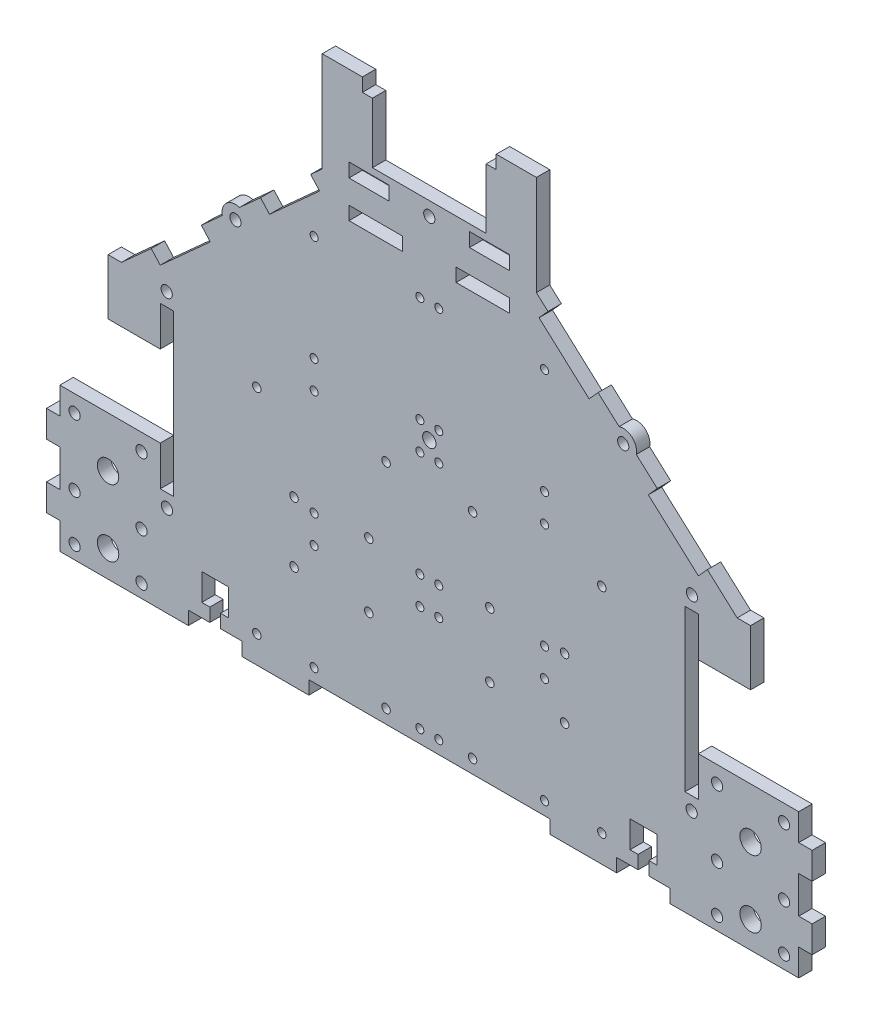
from build123d import *

# Parameters (mm, degrees)
SKETCH1_W               = 240
SKETCH1_H               = 210
BOSS_EXTRUDE1_DEPTH     = 5
SKETCH3_W               = 5
SKETCH3_H               = 65
BOSS_EXTRUDE2_DEPTH     = 20
SKETCH2_R               = 2.1
SKETCH2_R_2             = 4
CUT_EXTRUDE1_DEPTH      = 10
SKETCH4_W               = 55
SKETCH4_H               = 30.4
CUT_EXTRUDE2_DEPTH      = 20
SKETCH5_R               = 4
CUT_EXTRUDE4_DEPTH      = 10
SKETCH6_R               = 2.1
SKETCH6_W               = 5
SKETCH6_H               = 60
CUT_EXTRUDE5_DEPTH      = 10
CUT_EXTRUDE13_START     = -5
CUT_EXTRUDE13_DEPTH     = 5
SKETCH13_W              = 50
SKETCH13_H              = 5
CUT_EXTRUDE14_DEPTH     = 10
SKETCH14_W              = 15
SKETCH14_H              = 5.2
CUT_EXTRUDE15_DEPTH     = 10
CUT_EXTRUDE16_OUTLINE_R = 2.1
CUT_EXTRUDE16_DEPTH     = 5
BOSS_EXTRUDE3_DEPTH     = 5
CUT_EXTRUDE17_START     = -5
CUT_EXTRUDE17_OUTLINE_R = 1.5875
CUT_EXTRUDE17_DEPTH     = 5
CUT_EXTRUDE18_OUTLINE_R = 1.5
CUT_EXTRUDE18_DEPTH     = 5
CUT_EXTRUDE19_DEPTH     = 10
SKETCH20_R              = 2.1
CUT_EXTRUDE20_DEPTH     = 10
SKETCH21_R              = 2.1
CUT_EXTRUDE21_DEPTH     = 10
SKETCH22_R              = 2.5
CUT_EXTRUDE22_DEPTH     = 5
SKETCH24_W              = 4.2
SKETCH24_H              = 5
CUT_EXTRUDE24_DEPTH     = 10
SKETCH25_W              = 5
SKETCH25_H              = 53.8
CUT_EXTRUDE25_DEPTH     = 2
SKETCH26_W              = 5
SKETCH26_H              = 53.8
CUT_EXTRUDE26_DEPTH     = 2
SKETCH27_W              = 5
SKETCH27_H              = 10
BOSS_EXTRUDE4_DEPTH     = 5
SKETCH30_W              = 20
SKETCH30_H              = 5
CUT_EXTRUDE27_DEPTH     = 5
SKETCH32_W              = 90
SKETCH32_H              = 5
CUT_EXTRUDE28_DEPTH     = 5
SKETCH33_W              = 10
SKETCH33_H              = 10
SKETCH33_W_2            = 4
SKETCH33_H_2            = 5
CUT_EXTRUDE29_DEPTH     = 5
SKETCH34_W              = 10
SKETCH34_H              = 1.8
CUT_EXTRUDE30_DEPTH     = 5
BOSS_EXTRUDE8_DEPTH     = 5
SKETCH36_W              = 42.5
SKETCH36_H              = 10
CUT_EXTRUDE31_DEPTH     = 5
SKETCH37_W              = 7
SKETCH37_H              = 5
SKETCH37_W_2            = 4
SKETCH37_H_2            = 2.5
CUT_EXTRUDE32_DEPTH     = 5
BOSS_EXTRUDE9_START     = -5
SKETCH38_R              = 2.1
SKETCH38_W              = 5
SKETCH38_H              = 60
BOSS_EXTRUDE9_DEPTH     = 5
SKETCH39_W              = 42.5
SKETCH39_H              = 22.5
CUT_EXTRUDE33_DEPTH     = 5


# Read off the part's stored shape, not the designer's step: Cut-Extrude13, Cut-Extrude16, Cut-Extrude17, Cut-Extrude18
with BuildPart() as part:
    # Sketch1 → Boss-Extrude1 (new body)
    with BuildSketch(Plane.XY):
        with Locations((-120, 105)):
            Rectangle(SKETCH1_W, SKETCH1_H)
    extrude(amount=BOSS_EXTRUDE1_DEPTH)

    # Sketch3 → Boss-Extrude2 (add)
    with BuildSketch(Plane(origin=(0, 0, 0), x_dir=(0, 0, -1), z_dir=(1, 0, 0))):
        with Locations((-2.5, 32.5)):
            Rectangle(SKETCH3_W, SKETCH3_H)
    boss_extrude2 = extrude(amount=BOSS_EXTRUDE2_DEPTH)

    # Mirror1: Boss-Extrude2 across plane
    add(boss_extrude2.mirror(Plane.ZY.offset(120)))

    # Sketch2 → Cut-Extrude1 (cut)
    with BuildSketch(Plane.XY.offset(5)):
        with Locations((-12.5, 22.5)):
            Circle(SKETCH2_R)
        with Locations((0, 35)):
            Circle(SKETCH2_R_2)
        with Locations((12.5, 47.5)):
            Circle(SKETCH2_R)
        with Locations((-252.5, 47.5)):
            Circle(SKETCH2_R)
        with Locations((-240, 35)):
            Circle(SKETCH2_R_2)
        with Locations((-227.5, 22.5)):
            Circle(SKETCH2_R)
        with BuildLine():
            Line((-240.00216949, 53.8), (-220.500048658, 53.8))
            Line((-220.500048658, 53.8), (-220.500048658, 55.8))
            Line((-220.500048658, 55.8), (-220.500048658, 82.2))
            Line((-220.500048658, 82.2), (-220.500048658, 84.2))
            Line((-220.500048658, 84.2), (-240.00216949, 84.2))
            ThreePointArc((-240.00216949, 84.2), (-255.20216949, 69), (-240.00216949, 53.8))
        make_face()
        with BuildLine():
            Line((-19.499951342, 82.2), (-19.499951342, 84.2))
            Line((-19.499951342, 84.2), (0.00216949, 84.2))
            ThreePointArc((0.00216949, 84.2), (15.20216949, 69), (0.00216949, 53.8))
            Line((0.00216949, 53.8), (-19.499951342, 53.8))
            Line((-19.499951342, 53.8), (-19.499951342, 55.8))
            Line((-19.499951342, 55.8), (-19.499951342, 82.2))
        make_face()
    extrude(amount=-CUT_EXTRUDE1_DEPTH, mode=Mode.SUBTRACT)

    # Sketch4 → Cut-Extrude2 (cut)
    with BuildSketch(Plane.XY.offset(5)):
        with Locations((-246.18319816, 69)):
            Rectangle(SKETCH4_W, SKETCH4_H)
        with Locations((6.18319816, 69)):
            Rectangle(SKETCH4_W, SKETCH4_H)
    extrude(amount=-CUT_EXTRUDE2_DEPTH, mode=Mode.SUBTRACT)

    # Sketch5 → Cut-Extrude4 (cut)
    with BuildSketch(Plane.XY.offset(5)):
        with Locations((-240, 10)):
            Circle(SKETCH5_R)
        with Locations((0, 10)):
            Circle(SKETCH5_R)
    extrude(amount=-CUT_EXTRUDE4_DEPTH, mode=Mode.SUBTRACT)

    # Sketch6 → Cut-Extrude5 (cut)
    with BuildSketch(Plane.XY.offset(5)):
        with Locations((-218, 34)):
            Circle(SKETCH6_R)
        with Locations((-218.1, 104)):
            Circle(SKETCH6_R)
        with Locations((-203.1, 104)):
            Circle(SKETCH6_R)
        with Locations((-203, 34)):
            Circle(SKETCH6_R)
        with Locations((-37, 34)):
            Circle(SKETCH6_R)
        with Locations((-36.9, 104)):
            Circle(SKETCH6_R)
        with Locations((-22, 34)):
            Circle(SKETCH6_R)
        with Locations((-21.9, 104)):
            Circle(SKETCH6_R)
        with Locations((-218, 69)):
            Rectangle(SKETCH6_W, SKETCH6_H)
        with Locations((-203, 69)):
            Rectangle(SKETCH6_W, SKETCH6_H)
        with Locations((-37, 69)):
            Rectangle(SKETCH6_W, SKETCH6_H)
        with Locations((-22, 69)):
            Rectangle(SKETCH6_W, SKETCH6_H)
    extrude(amount=-CUT_EXTRUDE5_DEPTH, mode=Mode.SUBTRACT)

    # Cut-Extrude13 outline → Cut-Extrude13 (cut)
    with BuildSketch(Plane(origin=(0, 0, 0), x_dir=(-1, 0, 0), z_dir=(0, 0, -1)).offset(CUT_EXTRUDE13_START)):
        Polygon((170, 163.680555556), (235, 105), (240, 105), (240, 210), (170, 210), align=None)
        Polygon((70, 163.680555556), (70, 210), (0, 210), (0, 105), (5, 105), align=None)
    extrude(amount=CUT_EXTRUDE13_DEPTH, mode=Mode.SUBTRACT)

    # Sketch13 → Cut-Extrude14 (cut)
    with BuildSketch(Plane.XY.offset(5)):
        with Locations((-120, 207.5)):
            Rectangle(SKETCH13_W, SKETCH13_H)
    extrude(amount=-CUT_EXTRUDE14_DEPTH, mode=Mode.SUBTRACT)

    # Sketch14 → Cut-Extrude15 (cut)
    with BuildSketch(Plane.XY.offset(5)):
        with Locations((-142.5, 177.4)):
            Rectangle(SKETCH14_W, SKETCH14_H)
        with Locations((-97.5, 177.4)):
            Rectangle(SKETCH14_W, SKETCH14_H)
    extrude(amount=-CUT_EXTRUDE15_DEPTH, mode=Mode.SUBTRACT)

    # Cut-Extrude16 outline → Cut-Extrude16 (cut)
    with BuildSketch(Plane.XY):
        Polygon((-70, 175.067692308), (-79.01443299, 165.082474227), (-60.309278351, 148.195876289), (-56.958762887, 151.907216495), (-70, 163.680555556), align=None)
        Polygon((-16.134020619, 115.051546392), (-34.839175258, 131.93814433), (-38.189690722, 128.226804124), (-19.484536082, 111.340206186), align=None)
        Polygon((-201.810309278, 128.226804124), (-205.160824742, 131.93814433), (-223.865979381, 115.051546392), (-220.515463918, 111.340206186), align=None)
        Polygon((-179.690721649, 148.195876289), (-160.98556701, 165.082474227), (-170, 175.067692308), (-170, 163.680555556), (-183.041237113, 151.907216495), align=None)
        with Locations((-47.574226804, 140.067010309)):
            Circle(CUT_EXTRUDE16_OUTLINE_R)
        with Locations((-192.425773196, 140.067010309)):
            Circle(CUT_EXTRUDE16_OUTLINE_R)
    extrude(amount=CUT_EXTRUDE16_DEPTH, mode=Mode.SUBTRACT)

    # Sketch16 → Boss-Extrude3 (add)
    with BuildSketch(Plane.XY.offset(5)):
        with BuildLine():
            Line((-197.315145828, 139.021048905), (-190.886916027, 144.82431192))
            ThreePointArc((-190.886916027, 144.82431192), (-195.77628866, 143.778350515), (-197.315145828, 139.021048905))
        make_face()
        with BuildLine():
            Line((-42.684854172, 139.021048905), (-49.113083973, 144.82431192))
            ThreePointArc((-49.113083973, 144.82431192), (-44.22371134, 143.778350515), (-42.684854172, 139.021048905))
        make_face()
    extrude(amount=-BOSS_EXTRUDE3_DEPTH)

    # Cut-Extrude17 outline → Cut-Extrude17 (cut)
    with BuildSketch(Plane.XY.offset(5).offset(CUT_EXTRUDE17_START)):
        with Locations((-142.601004846, 62.025562398)):
            Circle(CUT_EXTRUDE17_OUTLINE_R)
        with Locations((-97.398995154, 37.974437602)):
            Circle(CUT_EXTRUDE17_OUTLINE_R)
        with Locations((-184.429681634, 89.892779237)):
            Circle(CUT_EXTRUDE17_OUTLINE_R)
        with Locations((-136.152974, 89.892779237)):
            Circle(CUT_EXTRUDE17_OUTLINE_R)
        with Locations((-170.531335353, 38.709446299)):
            Circle(CUT_EXTRUDE17_OUTLINE_R)
        with Locations((-69.468664647, 38.709446299)):
            Circle(CUT_EXTRUDE17_OUTLINE_R)
        with Locations((-103.847026, 89.892779237)):
            Circle(CUT_EXTRUDE17_OUTLINE_R)
        with Locations((-55.570318366, 89.892779237)):
            Circle(CUT_EXTRUDE17_OUTLINE_R)
        with Locations((-97.398995154, 62.025562398)):
            Circle(CUT_EXTRUDE17_OUTLINE_R)
        with Locations((-184.429681634, 10.107220763)):
            Circle(CUT_EXTRUDE17_OUTLINE_R)
        with Locations((-136.152974, 10.107220763)):
            Circle(CUT_EXTRUDE17_OUTLINE_R)
        with Locations((-170.531335353, 61.290553701)):
            Circle(CUT_EXTRUDE17_OUTLINE_R)
        with Locations((-142.601004846, 37.974437602)):
            Circle(CUT_EXTRUDE17_OUTLINE_R)
        with Locations((-55.570318366, 10.107220763)):
            Circle(CUT_EXTRUDE17_OUTLINE_R)
        with Locations((-103.847026, 10.107220763)):
            Circle(CUT_EXTRUDE17_OUTLINE_R)
        with Locations((-69.468664647, 61.290553701)):
            Circle(CUT_EXTRUDE17_OUTLINE_R)
    extrude(amount=CUT_EXTRUDE17_DEPTH, mode=Mode.SUBTRACT)

    # Cut-Extrude18 outline → Cut-Extrude18 (cut)
    with BuildSketch(Plane.XY):
        with Locations((-123.531606957, 49.385290972)):
            Circle(CUT_EXTRUDE18_OUTLINE_R)
        with Locations((-163.031606957, 149.385290972)):
            Circle(CUT_EXTRUDE18_OUTLINE_R)
        with Locations((-163.031606957, 109.885290972)):
            Circle(CUT_EXTRUDE18_OUTLINE_R)
        with Locations((-123.531606957, 109.885290972)):
            Circle(CUT_EXTRUDE18_OUTLINE_R)
        with Locations((-116.468393043, 149.385290972)):
            Circle(CUT_EXTRUDE18_OUTLINE_R)
        with Locations((-76.968393043, 149.385290972)):
            Circle(CUT_EXTRUDE18_OUTLINE_R)
        with Locations((-76.968393043, 109.885290972)):
            Circle(CUT_EXTRUDE18_OUTLINE_R)
        with Locations((-116.468393043, 109.885290972)):
            Circle(CUT_EXTRUDE18_OUTLINE_R)
        with Locations((-123.531606957, 99.385290972)):
            Circle(CUT_EXTRUDE18_OUTLINE_R)
        with Locations((-116.468393043, 9.885290972)):
            Circle(CUT_EXTRUDE18_OUTLINE_R)
        with Locations((-76.968393043, 9.885290972)):
            Circle(CUT_EXTRUDE18_OUTLINE_R)
        with Locations((-76.968393043, 49.385290972)):
            Circle(CUT_EXTRUDE18_OUTLINE_R)
        with Locations((-116.468393043, 49.385290972)):
            Circle(CUT_EXTRUDE18_OUTLINE_R)
        with Locations((-123.531606957, 9.885290972)):
            Circle(CUT_EXTRUDE18_OUTLINE_R)
        with Locations((-163.031606957, 9.885290972)):
            Circle(CUT_EXTRUDE18_OUTLINE_R)
        with Locations((-163.031606957, 49.385290972)):
            Circle(CUT_EXTRUDE18_OUTLINE_R)
        with Locations((-123.531606957, 149.385290972)):
            Circle(CUT_EXTRUDE18_OUTLINE_R)
        with Locations((-116.468393043, 59.885290972)):
            Circle(CUT_EXTRUDE18_OUTLINE_R)
        with Locations((-76.968393043, 59.885290972)):
            Circle(CUT_EXTRUDE18_OUTLINE_R)
        with Locations((-76.968393043, 99.385290972)):
            Circle(CUT_EXTRUDE18_OUTLINE_R)
        with Locations((-116.468393043, 99.385290972)):
            Circle(CUT_EXTRUDE18_OUTLINE_R)
        with Locations((-123.531606957, 59.885290972)):
            Circle(CUT_EXTRUDE18_OUTLINE_R)
        with Locations((-163.031606957, 59.885290972)):
            Circle(CUT_EXTRUDE18_OUTLINE_R)
        with Locations((-163.031606957, 99.385290972)):
            Circle(CUT_EXTRUDE18_OUTLINE_R)
    extrude(amount=CUT_EXTRUDE18_DEPTH, mode=Mode.SUBTRACT)

    # Sketch19 → Cut-Extrude19 (cut)
    with BuildSketch(Plane.XY.offset(5)):
        Polygon((-170, 210), (-170, 175.067692308), (-164.336082474, 168.793814433), (-160, 172.708333333), (-160, 210), align=None)
        Polygon((-70, 175.067692308), (-75.663917526, 168.793814433), (-80, 172.708333333), (-80, 210), (-70, 210), align=None)
    extrude(amount=-CUT_EXTRUDE19_DEPTH, mode=Mode.SUBTRACT)

    # Sketch20 → Cut-Extrude20 (cut)
    with BuildSketch(Plane.XY.offset(5)):
        with Locations((-227.5, 47.5)):
            Circle(SKETCH20_R)
        with Locations((-252.5, 5)):
            Circle(SKETCH20_R)
        with Locations((-227.5, 5)):
            Circle(SKETCH20_R)
        with Locations((12.5, 22.5)):
            Circle(SKETCH20_R)
        with Locations((12.5, 5)):
            Circle(SKETCH20_R)
        with Locations((-12.5, 5)):
            Circle(SKETCH20_R)
        with Locations((-12.5, 47.5)):
            Circle(SKETCH20_R)
        with Locations((-252.5, 22.5)):
            Circle(SKETCH20_R)
    extrude(amount=-CUT_EXTRUDE20_DEPTH, mode=Mode.SUBTRACT)

    # Sketch21 → Cut-Extrude21 (cut)
    with BuildSketch(Plane.XY.offset(5)):
        with Locations((-120, 177.4)):
            Circle(SKETCH21_R)
    extrude(amount=-CUT_EXTRUDE21_DEPTH, mode=Mode.SUBTRACT)

    # Sketch22 → Cut-Extrude22 (cut)
    with BuildSketch(Plane.XY.offset(5)):
        with Locations((-120, 105)):
            Circle(SKETCH22_R)
    extrude(amount=-CUT_EXTRUDE22_DEPTH, mode=Mode.SUBTRACT)

    # Sketch24 → Cut-Extrude24 (cut)
    with BuildSketch(Plane.XY.offset(5)):
        Polygon((-117.9, 200), (-122.1, 200), (-125, 200), (-125, 191.8), (-115, 191.8), (-115, 200), align=None)
        with Locations((-120, 202.5)):
            Rectangle(SKETCH24_W, SKETCH24_H)
    extrude(amount=-CUT_EXTRUDE24_DEPTH, mode=Mode.SUBTRACT)

    # Sketch25 → Cut-Extrude25 (cut)
    with BuildSketch(Plane(origin=(20, 0, 0), x_dir=(0, 0, -1), z_dir=(1, 0, 0))):
        with Locations((-2.5, 26.9)):
            Rectangle(SKETCH25_W, SKETCH25_H)
    extrude(amount=-CUT_EXTRUDE25_DEPTH, mode=Mode.SUBTRACT)

    # Sketch26 → Cut-Extrude26 (cut)
    with BuildSketch(Plane.ZY.offset(260)):
        with Locations((2.5, 26.9)):
            Rectangle(SKETCH26_W, SKETCH26_H)
    extrude(amount=-CUT_EXTRUDE26_DEPTH, mode=Mode.SUBTRACT)

    # Sketch27 → Boss-Extrude4 (add)
    with BuildSketch(Plane.XY.offset(5)):
        with Locations((-260.5, 15)):
            Rectangle(SKETCH27_W, SKETCH27_H)
        with Locations((-260.5, 38.8)):
            Rectangle(SKETCH27_W, SKETCH27_H)
        with Locations((20.5, 38.8)):
            Rectangle(SKETCH27_W, SKETCH27_H)
        with Locations((20.5, 15)):
            Rectangle(SKETCH27_W, SKETCH27_H)
    extrude(amount=-BOSS_EXTRUDE4_DEPTH)

    # Sketch30 → Cut-Extrude27 (cut)
    with BuildSketch(Plane.XY.offset(5)):
        with Locations((-140, 163.5)):
            Rectangle(SKETCH30_W, SKETCH30_H)
        with Locations((-100, 163.5)):
            Rectangle(SKETCH30_W, SKETCH30_H)
    extrude(amount=-CUT_EXTRUDE27_DEPTH, mode=Mode.SUBTRACT)

    # Sketch32 → Cut-Extrude28 (cut)
    with BuildSketch(Plane.XY.offset(5)):
        with Locations((-120, 2.5)):
            Rectangle(SKETCH32_W, SKETCH32_H)
    extrude(amount=-CUT_EXTRUDE28_DEPTH, mode=Mode.SUBTRACT)

    # Sketch33 → Cut-Extrude29 (cut)
    with BuildSketch(Plane.XY.offset(5)):
        with Locations((-200, 15)):
            Rectangle(SKETCH33_W, SKETCH33_H)
        Polygon((-45, 10), (-42, 10), (-38, 10), (-35, 10), (-35, 20), (-45, 20), align=None)
        with Locations((-40, 7.5)):
            Rectangle(SKETCH33_W_2, SKETCH33_H_2)
        with Locations((-200, 7.5)):
            Rectangle(SKETCH33_W_2, SKETCH33_H_2)
        Polygon((-38, 5), (-42, 5), (-50, 5), (-50, 0), (-30, 0), (-30, 5), align=None)
        Polygon((-198, 5), (-202, 5), (-210, 5), (-210, 0), (-190, 0), (-190, 5), align=None)
    extrude(amount=-CUT_EXTRUDE29_DEPTH, mode=Mode.SUBTRACT)

    # Sketch34 → Cut-Extrude30 (cut)
    with BuildSketch(Plane.XY.offset(5)):
        with Locations((-120, 190.9)):
            Rectangle(SKETCH34_W, SKETCH34_H)
    extrude(amount=-CUT_EXTRUDE30_DEPTH, mode=Mode.SUBTRACT)

    # Sketch35 → Boss-Extrude8 (add)
    with BuildSketch(Plane.XY.offset(5)):
        Polygon((-122.1, 205), (-122.1, 200), (-125, 200), (-125, 190), (-115, 190), (-115, 200), (-117.9, 200), (-117.9, 205), align=None)
    extrude(amount=-BOSS_EXTRUDE8_DEPTH)

    # Sketch36 → Cut-Extrude31 (cut)
    with BuildSketch(Plane.XY.offset(5)):
        with Locations((-120, 192.5)):
            Rectangle(SKETCH36_W, SKETCH36_H)
    extrude(amount=-CUT_EXTRUDE31_DEPTH, mode=Mode.SUBTRACT)

    # Sketch37 → Cut-Extrude32 (cut)
    with BuildSketch(Plane.XY.offset(5)):
        with Locations((-120, 200)):
            Rectangle(SKETCH37_W, SKETCH37_H)
        with Locations((-120, 203.75)):
            Rectangle(SKETCH37_W_2, SKETCH37_H_2)
    extrude(amount=-CUT_EXTRUDE32_DEPTH, mode=Mode.SUBTRACT)

    # Sketch38 → Boss-Extrude9 (add)
    with BuildSketch(Plane(origin=(0, 0, 0), x_dir=(-1, 0, 0), z_dir=(0, 0, -1)).offset(BOSS_EXTRUDE9_START)):
        with Locations((203.1, 104)):
            Circle(SKETCH38_R)
        with Locations((203, 34)):
            Circle(SKETCH38_R)
        with Locations((36.9, 104)):
            Circle(SKETCH38_R)
        with Locations((37, 34)):
            Circle(SKETCH38_R)
        with Locations((203, 69)):
            Rectangle(SKETCH38_W, SKETCH38_H)
        with Locations((37, 69)):
            Rectangle(SKETCH38_W, SKETCH38_H)
    extrude(amount=BOSS_EXTRUDE9_DEPTH)

    # Sketch39 → Cut-Extrude33 (cut)
    with BuildSketch(Plane.XY.offset(5)):
        with Locations((-120, 193.75)):
            Rectangle(SKETCH39_W, SKETCH39_H)
    extrude(amount=-CUT_EXTRUDE33_DEPTH, mode=Mode.SUBTRACT)


solid = part.part
